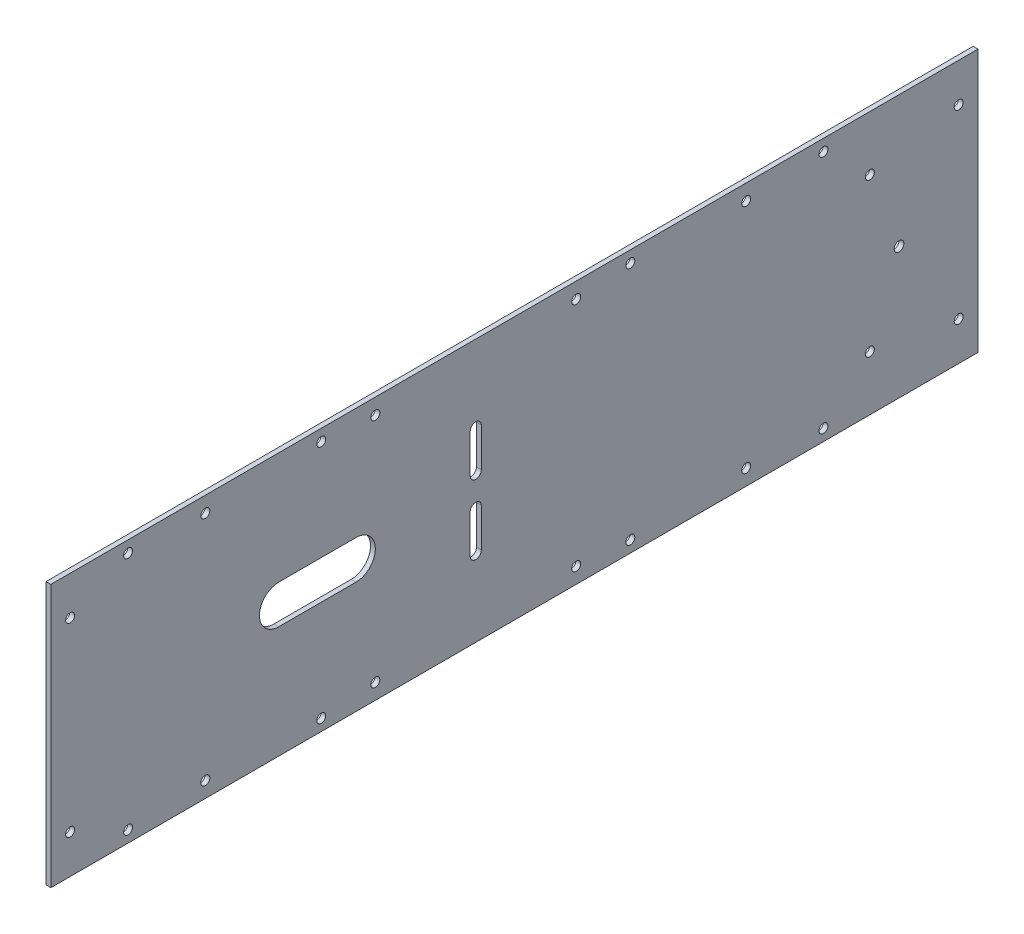
from build123d import *

# Parameters (mm, degrees)
SKETCH1_W                     = 304.8
SKETCH1_H                     = 86.36
BOSS_EXTRUDE1_DEPTH           = 1.5875
F_4_CLEARANCE_HOLE1_OUTLINE_R = 1.4732
F_4_CLEARANCE_HOLE1_DEPTH     = 1.5875
F_1_8_0_125_DIAMETER_HOLE1_D  = 3.175
CUT_EXTRUDE1_DEPTH            = 317.802161855
F_4_CLEARANCE_HOLE2_D         = 2.9464
F_4_CLEARANCE_HOLE2_DEPTH     = 9.1694
F_4_CLEARANCE_HOLE2_TIP       = 0.885187864
CUT_EXTRUDE3_DEPTH            = 317.802161855
F_4_CLEARANCE_HOLE3_D         = 2.9464
F_4_CLEARANCE_HOLE3_DEPTH     = 9.1694
F_4_CLEARANCE_HOLE3_TIP       = 0.885187864


# Read off the part's stored shape, not the designer's step: #4 Clearance Hole1
with BuildPart() as part:
    # Sketch1 → Boss-Extrude1 (new body)
    with BuildSketch(Plane(origin=(0, 0, 0), x_dir=(0, 0, -1), z_dir=(1, 0, 0))):
        with Locations((152.4, 43.18)):
            Rectangle(SKETCH1_W, SKETCH1_H)
    extrude(amount=BOSS_EXTRUDE1_DEPTH)

    # #4 Clearance Hole1 outline → #4 Clearance Hole1 (cut)
    with BuildSketch(Plane.YZ):
        with Locations((68.36, -269.24)):
            Circle(F_4_CLEARANCE_HOLE1_OUTLINE_R)
        with Locations((18, -269.24)):
            Circle(F_4_CLEARANCE_HOLE1_OUTLINE_R)
        with Locations((82.55, -25.4)):
            Circle(F_4_CLEARANCE_HOLE1_OUTLINE_R)
        with Locations((82.55, -88.9)):
            Circle(F_4_CLEARANCE_HOLE1_OUTLINE_R)
        with Locations((82.55, -190.5)):
            Circle(F_4_CLEARANCE_HOLE1_OUTLINE_R)
        with Locations((82.55, -254)):
            Circle(F_4_CLEARANCE_HOLE1_OUTLINE_R)
        with Locations((3.81, -254)):
            Circle(F_4_CLEARANCE_HOLE1_OUTLINE_R)
        with Locations((3.81, -190.5)):
            Circle(F_4_CLEARANCE_HOLE1_OUTLINE_R)
        with Locations((3.81, -88.9)):
            Circle(F_4_CLEARANCE_HOLE1_OUTLINE_R)
        with Locations((3.81, -25.4)):
            Circle(F_4_CLEARANCE_HOLE1_OUTLINE_R)
    extrude(amount=F_4_CLEARANCE_HOLE1_DEPTH, mode=Mode.SUBTRACT)

    # 1/8 (0.125) Diameter Hole1 (through all)
    with Locations(Plane(origin=(1.5875, 0, 0), x_dir=(0, 0, -1), z_dir=(1, 0, 0))):
        with Locations((278.8359549, 43.18)):
            Hole(F_1_8_0_125_DIAMETER_HOLE1_D / 2)

    # Sketch6 → Cut-Extrude1 (cut, through all)
    with BuildSketch(Plane(origin=(1.5875, 0, 0), x_dir=(0, 0, -1), z_dir=(1, 0, 0))):
        with BuildLine():
            Line((141.5288, 60.96), (141.5288, 48.26))
            ThreePointArc((141.5288, 48.26), (139.7, 46.4312), (137.8712, 48.26))
            Line((137.8712, 48.26), (137.8712, 60.96))
            ThreePointArc((137.8712, 60.96), (139.7, 62.7888), (141.5288, 60.96))
        make_face()
        with BuildLine():
            Line((141.5288, 25.4), (141.5288, 38.1))
            ThreePointArc((141.5288, 38.1), (139.7, 39.9288), (137.8712, 38.1))
            Line((137.8712, 38.1), (137.8712, 25.4))
            ThreePointArc((137.8712, 25.4), (139.7, 23.5712), (141.5288, 25.4))
        make_face()
    extrude(amount=-CUT_EXTRUDE1_DEPTH, mode=Mode.SUBTRACT)

    # #4 Clearance Hole2
    with Locations(Plane.ZY):
        with Locations((-228.6, 5.1562), (-228.6, 81.2038), (-172.72, 5.1562), (-172.72, 81.2038), (-106.68, 5.1562), (-50.8, 5.1562), (-106.68, 81.2038), (-50.8, 81.2038)):
            Hole(F_4_CLEARANCE_HOLE2_D / 2, depth=F_4_CLEARANCE_HOLE2_DEPTH)
            with Locations((0, 0, -(F_4_CLEARANCE_HOLE2_DEPTH + F_4_CLEARANCE_HOLE2_TIP / 2))):  # 118° drill point
                Cone(0, F_4_CLEARANCE_HOLE2_D / 2, F_4_CLEARANCE_HOLE2_TIP, mode=Mode.SUBTRACT)

    # Sketch10 → Cut-Extrude3 (cut, through all)
    with BuildSketch(Plane.ZY):
        with BuildLine():
            Line((-100.33, 49.53), (-74.93, 49.53))
            ThreePointArc((-74.93, 49.53), (-68.58, 43.18), (-74.93, 36.83))
            Line((-74.93, 36.83), (-100.33, 36.83))
            ThreePointArc((-100.33, 36.83), (-106.68, 43.18), (-100.33, 49.53))
        make_face()
    extrude(amount=-CUT_EXTRUDE3_DEPTH, mode=Mode.SUBTRACT)

    # #4 Clearance Hole3
    with Locations(Plane.ZY):
        with Locations((-6.35, 12.7), (-6.35, 73.66), (-298.45, 12.7), (-298.45, 73.66)):
            Hole(F_4_CLEARANCE_HOLE3_D / 2, depth=F_4_CLEARANCE_HOLE3_DEPTH)
            with Locations((0, 0, -(F_4_CLEARANCE_HOLE3_DEPTH + F_4_CLEARANCE_HOLE3_TIP / 2))):  # 118° drill point
                Cone(0, F_4_CLEARANCE_HOLE3_D / 2, F_4_CLEARANCE_HOLE3_TIP, mode=Mode.SUBTRACT)


solid = part.part
